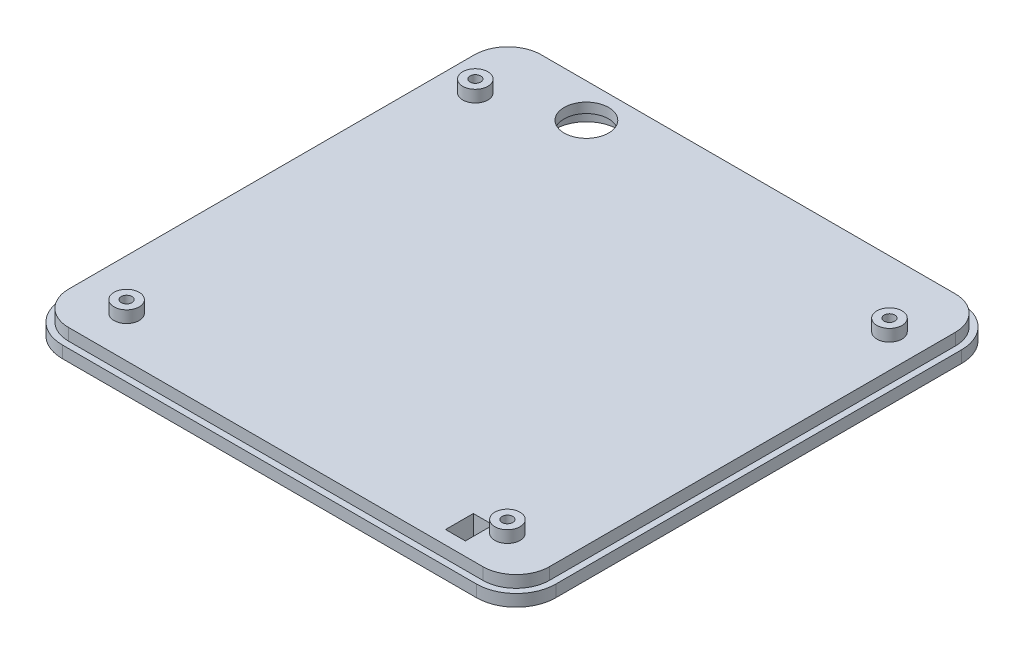
from build123d import *

# Parameters (mm, degrees)
SKETCH1_R           = 1.35
BOSS_EXTRUDE1_DEPTH = 6
SKETCH2_R           = 2.5
SKETCH2_R_2         = 1.35
CUT_EXTRUDE1_DEPTH  = 3
SKETCH3_R           = 3.175
SKETCH3_R_2         = 1.35
BOSS_EXTRUDE2_DEPTH = 3
CUT_EXTRUDE2_START  = -3
CUT_EXTRUDE2_DEPTH  = 3
SKETCH7_R           = 5.6
CUT_EXTRUDE3_DEPTH  = 10
CUT_EXTRUDE4_START  = -3.5
SKETCH8_R           = 8
SKETCH8_R_2         = 5.6
CUT_EXTRUDE4_DEPTH  = 3.5
SKETCH9_W           = 5
SKETCH9_H           = 7
CUT_EXTRUDE5_DEPTH  = 92.268613627


with BuildPart() as part:
    # Sketch1 → Boss-Extrude1 (new body)
    with BuildSketch(Plane(origin=(0, 0, 0), x_dir=(1, 0, 0), z_dir=(0, 1, 0))):
        with BuildLine():
            Line((52.2, 66.182473763), (-52.2, 66.182473763))
            ThreePointArc((-52.2, 66.182473763), (-59.271067812, 63.253541574), (-62.2, 56.182473763))
            Line((-62.2, 56.182473763), (-62.2, -46.121814954))
            ThreePointArc((-62.2, -46.121814954), (-59.271067812, -53.192882766), (-52.2, -56.121814954))
            Line((-52.2, -56.121814954), (52.2, -56.121814954))
            ThreePointArc((52.2, -56.121814954), (59.271067812, -53.192882766), (62.2, -46.121814954))
            Line((62.2, -46.121814954), (62.2, 56.182473763))
            ThreePointArc((62.2, 56.182473763), (59.271067812, 63.253541574), (52.2, 66.182473763))
        make_face()
        with Locations((-48, -44.121814954)):
            Circle(SKETCH1_R, mode=Mode.SUBTRACT)
        with Locations((48, -44.121814954)):
            Circle(SKETCH1_R, mode=Mode.SUBTRACT)
        with Locations((-52.2, 47.982473763)):
            Circle(SKETCH1_R, mode=Mode.SUBTRACT)
        with Locations((52.2, 47.982473763)):
            Circle(SKETCH1_R, mode=Mode.SUBTRACT)
    extrude(amount=BOSS_EXTRUDE1_DEPTH)

    # Sketch2 → Cut-Extrude1 (cut)
    # profile 1 of 4: a face of its own
    with BuildSketch(Plane.XZ):
        with Locations((-48, 44.121814954)):
            Circle(SKETCH2_R)
        with Locations((-48, 44.121814954)):
            Circle(SKETCH2_R_2, mode=Mode.SUBTRACT)
    # profile 2 of 4: a face of its own
    with BuildSketch(Plane.XZ):
        with Locations((48, 44.121814954)):
            Circle(SKETCH2_R)
        with Locations((48, 44.121814954)):
            Circle(SKETCH2_R_2, mode=Mode.SUBTRACT)
    # profile 3 of 4: a face of its own
    with BuildSketch(Plane.XZ):
        with Locations((52.2, -47.982473763)):
            Circle(SKETCH2_R)
        with Locations((52.2, -47.982473763)):
            Circle(SKETCH2_R_2, mode=Mode.SUBTRACT)
    # profile 4 of 4: a face of its own
    with BuildSketch(Plane.XZ):
        with Locations((-52.2, -47.982473763)):
            Circle(SKETCH2_R)
        with Locations((-52.2, -47.982473763)):
            Circle(SKETCH2_R_2, mode=Mode.SUBTRACT)
    extrude(amount=-CUT_EXTRUDE1_DEPTH, mode=Mode.SUBTRACT)

    # Sketch3 → Boss-Extrude2 (add)
    # profile 1 of 4: a face of its own
    with BuildSketch(Plane(origin=(0, 6, 0), x_dir=(1, 0, 0), z_dir=(0, 1, 0))):
        with Locations((-52.2, 47.982473763)):
            Circle(SKETCH3_R)
        with Locations((-52.2, 47.982473763)):
            Circle(SKETCH3_R_2, mode=Mode.SUBTRACT)
    # profile 2 of 4: a face of its own
    with BuildSketch(Plane(origin=(0, 6, 0), x_dir=(1, 0, 0), z_dir=(0, 1, 0))):
        with Locations((52.2, 47.982473763)):
            Circle(SKETCH3_R)
        with Locations((52.2, 47.982473763)):
            Circle(SKETCH3_R_2, mode=Mode.SUBTRACT)
    # profile 3 of 4: a face of its own
    with BuildSketch(Plane(origin=(0, 6, 0), x_dir=(1, 0, 0), z_dir=(0, 1, 0))):
        with Locations((48, -44.121814954)):
            Circle(SKETCH3_R)
        with Locations((48, -44.121814954)):
            Circle(SKETCH3_R_2, mode=Mode.SUBTRACT)
    # profile 4 of 4: a face of its own
    with BuildSketch(Plane(origin=(0, 6, 0), x_dir=(1, 0, 0), z_dir=(0, 1, 0))):
        with Locations((-48, -44.121814954)):
            Circle(SKETCH3_R)
        with Locations((-48, -44.121814954)):
            Circle(SKETCH3_R_2, mode=Mode.SUBTRACT)
    extrude(amount=BOSS_EXTRUDE2_DEPTH)

    # Sketch4 → Cut-Extrude2 (cut)
    with BuildSketch(Plane(origin=(0, 6, 0), x_dir=(1, 0, 0), z_dir=(0, 1, 0)).offset(CUT_EXTRUDE2_START)):
        with BuildLine():
            Line((52.2, 66.182473763), (-52.2, 66.182473763))
            ThreePointArc((-52.2, 66.182473763), (-59.271067812, 63.253541574), (-62.2, 56.182473763))
            Line((-62.2, 56.182473763), (-62.2, -46.121814954))
            ThreePointArc((-62.2, -46.121814954), (-59.271067812, -53.192882766), (-52.2, -56.121814954))
            Line((-52.2, -56.121814954), (52.2, -56.121814954))
            ThreePointArc((52.2, -56.121814954), (59.271067812, -53.192882766), (62.2, -46.121814954))
            Line((62.2, -46.121814954), (62.2, 56.182473763))
            ThreePointArc((62.2, 56.182473763), (59.271067812, 63.253541574), (52.2, 66.182473763))
        make_face()
        with BuildLine():
            Line((-60.6, 56.182473763), (-60.6, -46.121814954))
            ThreePointArc((-60.6, -46.121814954), (-58.139696962, -52.061511916), (-52.2, -54.521814954))
            Line((-52.2, -54.521814954), (52.2, -54.521814954))
            ThreePointArc((52.2, -54.521814954), (58.139696962, -52.061511916), (60.6, -46.121814954))
            Line((60.6, -46.121814954), (60.6, 56.182473763))
            ThreePointArc((60.6, 56.182473763), (58.139696962, 62.122170725), (52.2, 64.582473763))
            Line((52.2, 64.582473763), (-52.2, 64.582473763))
            ThreePointArc((-52.2, 64.582473763), (-58.139696962, 62.122170725), (-60.6, 56.182473763))
        make_face(mode=Mode.SUBTRACT)
    extrude(amount=CUT_EXTRUDE2_DEPTH, mode=Mode.SUBTRACT)

    # Sketch7 → Cut-Extrude3 (cut)
    with BuildSketch(Plane(origin=(0, 6, 0), x_dir=(1, 0, 0), z_dir=(0, 1, 0))):
        with Locations((-32.2, 55.982473763)):
            Circle(SKETCH7_R)
    extrude(amount=-CUT_EXTRUDE3_DEPTH, mode=Mode.SUBTRACT)

    # Sketch8 → Cut-Extrude4 (cut)
    with BuildSketch(Plane.XZ.offset(CUT_EXTRUDE4_START)):
        with Locations((-32.2, -55.982473763)):
            Circle(SKETCH8_R)
        with Locations((-32.2, -55.982473763)):
            Circle(SKETCH8_R_2, mode=Mode.SUBTRACT)
    extrude(amount=CUT_EXTRUDE4_DEPTH, mode=Mode.SUBTRACT)

    # Sketch9 → Cut-Extrude5 (cut, through all)
    with BuildSketch(Plane.XZ):
        with Locations((41.9, 47.621814954)):
            Rectangle(SKETCH9_W, SKETCH9_H)
    extrude(amount=-CUT_EXTRUDE5_DEPTH, mode=Mode.SUBTRACT)


solid = part.part
